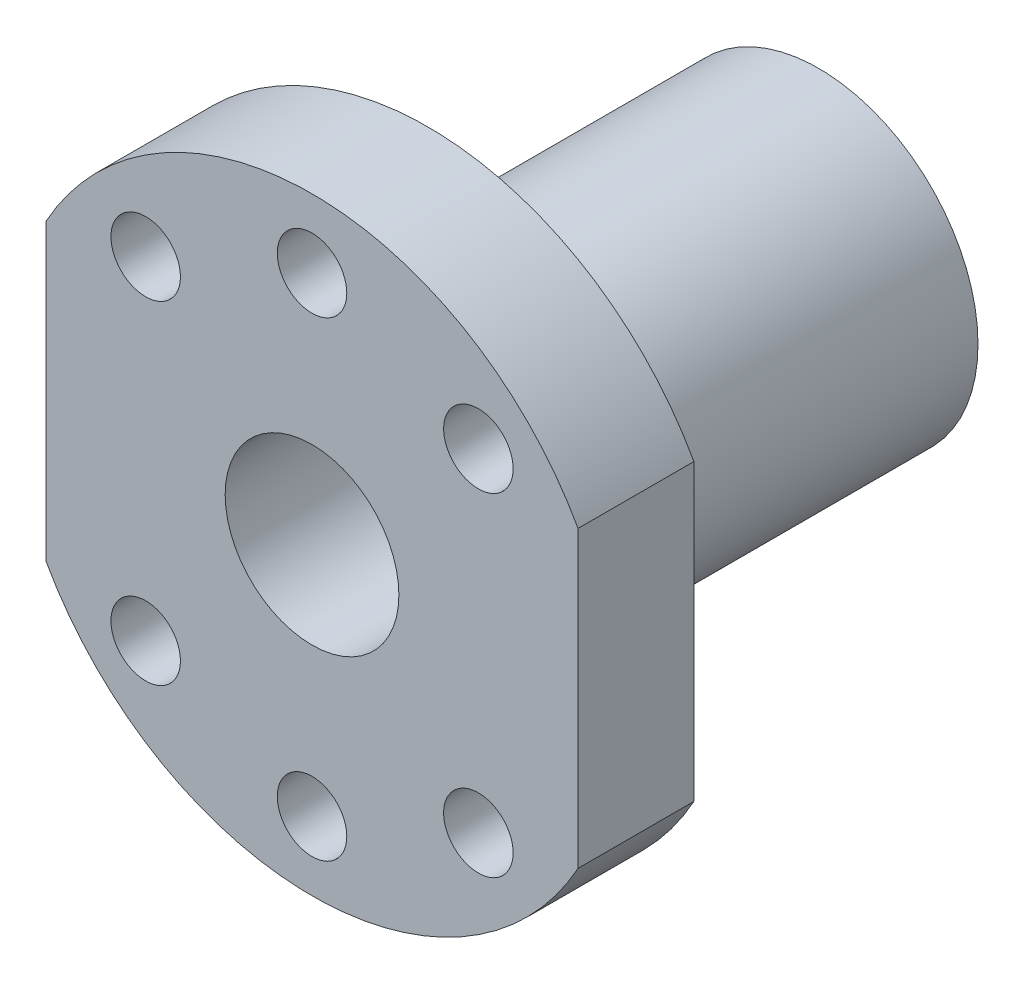
from build123d import *
from build123d.topology import SkipClean

# Parameters (mm, degrees)
SKETCH1_R           = 6
BOSS_EXTRUDE1_DEPTH = 4
SKETCH2_R           = 2.4
CUT_EXTRUDE1_DEPTH  = 30.028272856
BOSS_EXTRUDE2_START = 27
SKETCH3_R           = 11
SKETCH3_R_2         = 6
BOSS_EXTRUDE2_DEPTH = 27


with BuildPart() as part:
    # Sketch1 → Boss-Extrude1 (new, symmetric)
    with BuildSketch(Plane.XY):
        with BuildLine():
            Line((-18.375, 10.166581284), (-18.375, -10.166581284))
            ThreePointArc((-18.375, -10.166581284), (0, -21), (18.375, -10.166581284))
            Line((18.375, -10.166581284), (18.375, 10.166581284))
            ThreePointArc((18.375, 10.166581284), (0, 21), (-18.375, 10.166581284))
        make_face()
        Circle(SKETCH1_R, mode=Mode.SUBTRACT)
    extrude(amount=BOSS_EXTRUDE1_DEPTH, both=True)

    # Sketch2 → Cut-Extrude1 (cut, through all)
    with BuildSketch(Plane.XY.offset(4)):
        with Locations((-11.490485194, 11.490485194)):
            Circle(SKETCH2_R)
        with Locations((0, 16.25)):
            Circle(SKETCH2_R)
        with Locations((11.490485194, 11.490485194)):
            Circle(SKETCH2_R)
        with Locations((11.490485194, -11.490485194)):
            Circle(SKETCH2_R)
        with Locations((0, -16.25)):
            Circle(SKETCH2_R)
        with Locations((-11.490485194, -11.490485194)):
            Circle(SKETCH2_R)
    extrude(amount=-CUT_EXTRUDE1_DEPTH, mode=Mode.SUBTRACT)

    # Sketch3 → Boss-Extrude2 (add)
    with SkipClean():  # the faces are left unmerged after this step: merging them gives an invalid solid
        with BuildSketch(Plane(origin=(0, 0, -4), x_dir=(-1, 0, 0), z_dir=(0, 0, -1)).offset(BOSS_EXTRUDE2_START)):
            Circle(SKETCH3_R)
            Circle(SKETCH3_R_2, mode=Mode.SUBTRACT)
        extrude(amount=-BOSS_EXTRUDE2_DEPTH)


solid = part.part
